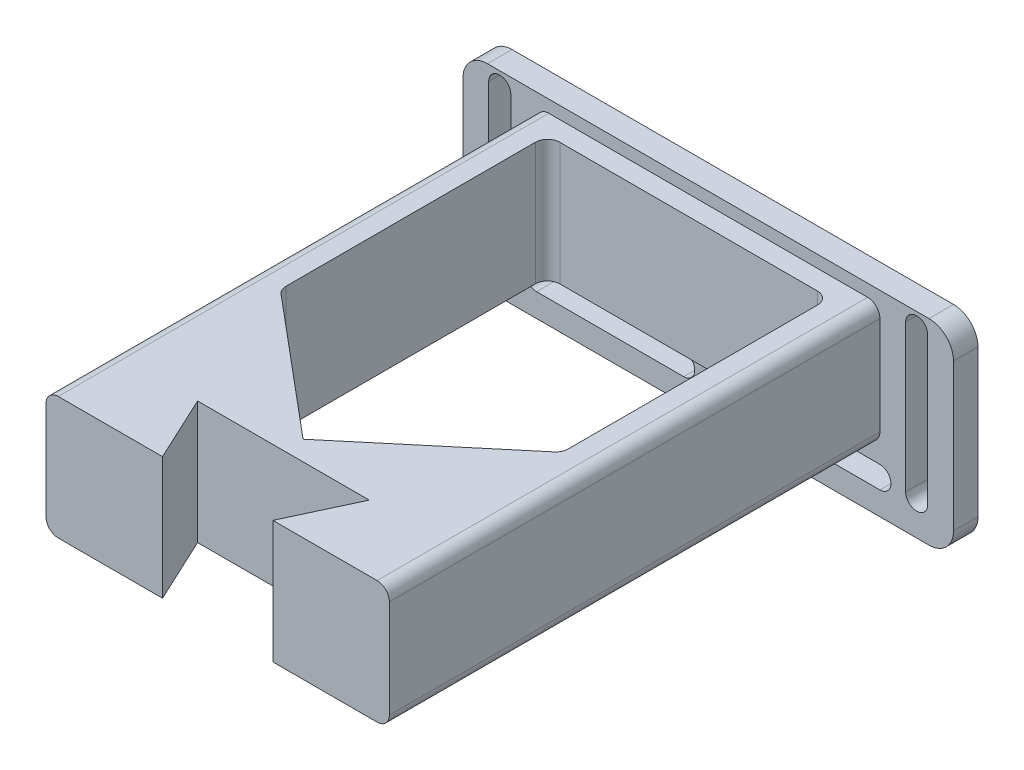
from build123d import *

# Parameters (mm, degrees)
SKETCH1_W               = 100
SKETCH1_H               = 40
BOSS_EXTRUDE1_DEPTH     = 5
CUT_EXTRUDE1_DEPTH      = 5
CUT_EXTRUDE2_DEPTH      = 5
CUT_EXTRUDE3_DEPTH      = 5
CUT_EXTRUDE4_DEPTH      = 5
SKETCH3_W               = 70
SKETCH3_H               = 25
BOSS_EXTRUDE2_DEPTH     = 100
FILLET1_R               = 5
FILLET2_R               = 2.5
CUT_EXTRUDE6_DEPTH      = 120.504184027
CUT_EXTRUDE6_DEPTH_BACK = 120.504184027
CUT_EXTRUDE8_DEPTH      = 120.504184027
FILLET3_R               = 2.5


with BuildPart() as part:
    # Sketch1 → Boss-Extrude1 (new body)
    with BuildSketch(Plane.XY):
        Rectangle(SKETCH1_W, SKETCH1_H)
    extrude(amount=BOSS_EXTRUDE1_DEPTH)

    # Sketch2 → Cut-Extrude1 (cut)
    with BuildSketch(Plane.XY.offset(5)):
        with BuildLine():
            Line((-40.25, 17), (-40.25, -13))
            ThreePointArc((-40.25, -13), (-42.5, -15.25), (-44.75, -13))
            Line((-44.75, -13), (-44.75, 17))
            ThreePointArc((-44.75, 17), (-42.5, 19.25), (-40.25, 17))
        make_face()
    extrude(amount=-CUT_EXTRUDE1_DEPTH, mode=Mode.SUBTRACT)

    # Sketch2<3> → Cut-Extrude2 (cut)
    with BuildSketch(Plane.XY.offset(5)):
        with BuildLine():
            Line((-35, -10.75), (-5, -10.75))
            ThreePointArc((-5, -10.75), (-2.75, -13), (-5, -15.25))
            Line((-5, -15.25), (-35, -15.25))
            ThreePointArc((-35, -15.25), (-37.25, -13), (-35, -10.75))
        make_face()
    extrude(amount=-CUT_EXTRUDE2_DEPTH, mode=Mode.SUBTRACT)

    # Sketch2<4> → Cut-Extrude3 (cut)
    with BuildSketch(Plane.XY.offset(5)):
        with BuildLine():
            Line((5, -10.75), (35, -10.75))
            ThreePointArc((35, -10.75), (37.25, -13), (35, -15.25))
            Line((35, -15.25), (5, -15.25))
            ThreePointArc((5, -15.25), (2.75, -13), (5, -10.75))
        make_face()
    extrude(amount=-CUT_EXTRUDE3_DEPTH, mode=Mode.SUBTRACT)

    # Sketch2<5> → Cut-Extrude4 (cut)
    with BuildSketch(Plane.XY.offset(5)):
        with BuildLine():
            Line((44.75, 17), (44.75, -13))
            ThreePointArc((44.75, -13), (42.5, -15.25), (40.25, -13))
            Line((40.25, -13), (40.25, 17))
            ThreePointArc((40.25, 17), (42.5, 19.25), (44.75, 17))
        make_face()
    extrude(amount=-CUT_EXTRUDE4_DEPTH, mode=Mode.SUBTRACT)

    # Sketch3 → Boss-Extrude2 (add)
    with BuildSketch(Plane.XY.offset(5)):
        with Locations((0, 5)):
            Rectangle(SKETCH3_W, SKETCH3_H)
    extrude(amount=BOSS_EXTRUDE2_DEPTH)

    # Fillet1
    fillet1_edges = [part.edges().sort_by_distance(p)[0] for p in [
        (-50, 20, 2.5),
        (50, 20, 2.5),
        (50, -20, 2.5),
        (-50, -20, 2.5),
    ]]
    fillet(fillet1_edges, radius=FILLET1_R)

    # Fillet2
    fillet2_edges = [part.edges().sort_by_distance(p)[0] for p in [
        (-35, 17.5, 55),
        (35, 17.5, 55),
        (35, -7.5, 55),
        (-35, -7.5, 55),
    ]]
    fillet(fillet2_edges, radius=FILLET2_R)

    # Sketch5 → Cut-Extrude6 (cut, two sides: drawn at the far end of the back side and taken through both)
    with BuildSketch(Plane.XZ.offset(7.5).offset(-CUT_EXTRUDE6_DEPTH_BACK)):
        Polygon((-11.25, 105), (-17.5, 91.596831747), (17.5, 91.596831747), (11.25, 105), align=None)
    extrude(amount=CUT_EXTRUDE6_DEPTH + CUT_EXTRUDE6_DEPTH_BACK, mode=Mode.SUBTRACT)

    # Sketch8 → Cut-Extrude8 (cut, through all)
    with BuildSketch(Plane.XZ.offset(7.5)):
        Polygon((-28.75, 9), (28.75, 9), (28.75, 63.47271735), (0, 87.596831747), (-28.75, 63.47271735), align=None)
    extrude(amount=-CUT_EXTRUDE8_DEPTH, mode=Mode.SUBTRACT)

    # Fillet3
    fillet3_edges = [part.edges().sort_by_distance(p)[0] for p in [
        (28.75, 5, 63.47271735),
        (-28.75, 5, 63.47271735),
        (28.75, 5, 9),
        (-28.75, 5, 9),
    ]]
    fillet(fillet3_edges, radius=FILLET3_R)


solid = part.part
